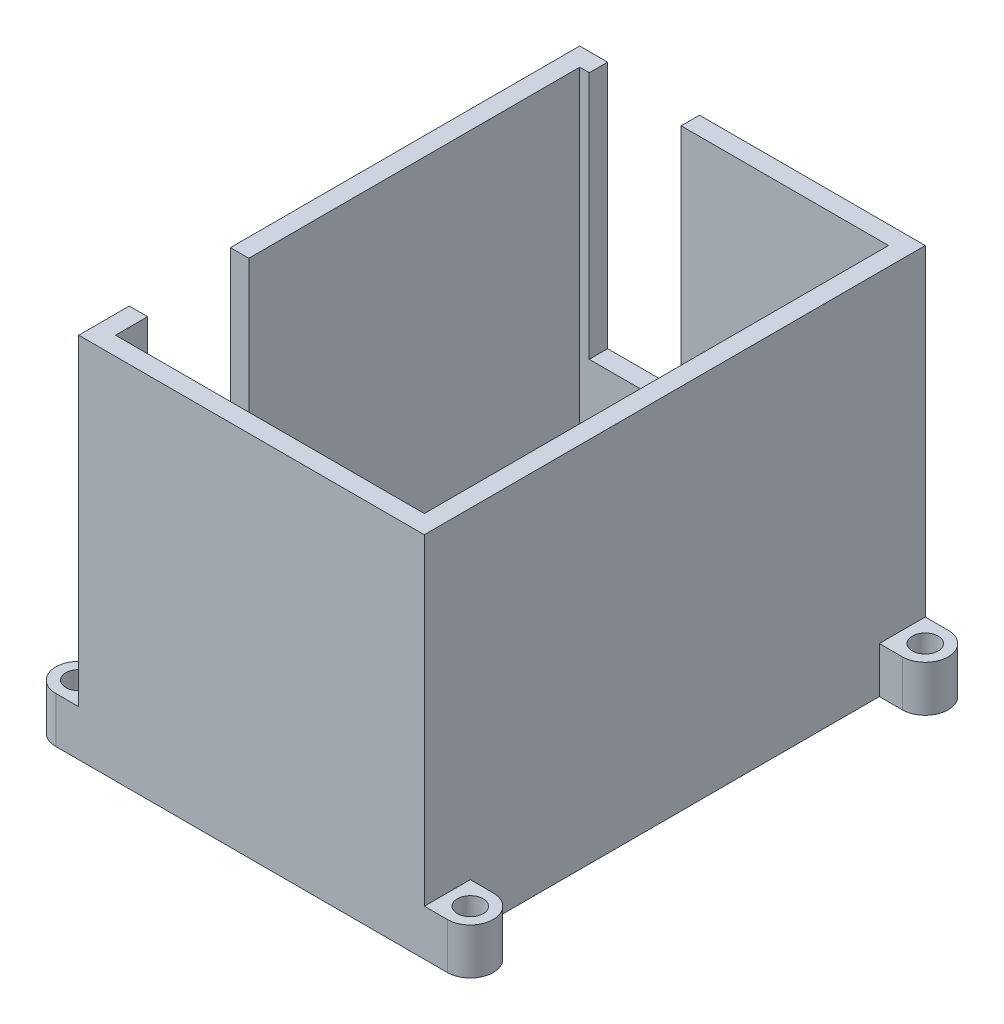
from build123d import *

# Parameters (mm, degrees)
SKETCH1_W                       = 47.752
SKETCH1_H                       = 69.215
SKETCH1_W_2                     = 42.672
SKETCH1_H_2                     = 64.135
BOSS_EXTRUDE1_DEPTH             = 50.8
BOSS_EXTRUDE2_DEPTH             = 6.35
F_9_64_0_14063_DIAMETER_HOLE1_D = 3.572002
SKETCH11_W                      = 13.97
SKETCH11_H                      = 38.735
CUT_EXTRUDE1_DEPTH              = 6.35
SKETCH12_W                      = 12.7
SKETCH12_H                      = 34.29
CUT_EXTRUDE2_DEPTH              = 6.35


with BuildPart() as part:
    # Sketch1 → Boss-Extrude1 (new body)
    with BuildSketch(Plane(origin=(0, 0, 0), x_dir=(1, 0, 0), z_dir=(0, 1, 0))):
        with Locations((21.336, 32.0675)):
            Rectangle(SKETCH1_W, SKETCH1_H)
        with Locations((21.336, 32.0675)):
            Rectangle(SKETCH1_W_2, SKETCH1_H_2, mode=Mode.SUBTRACT)
    extrude(amount=BOSS_EXTRUDE1_DEPTH)

    # Sketch2 → Boss-Extrude2 (add)
    with BuildSketch(Plane.XZ):
        with BuildLine():
            Line((-5.715, -3.81), (-2.54, -3.81))
            Line((-2.54, -3.81), (-2.54, 2.54))
            Line((-2.54, 2.54), (-5.715, 2.54))
            ThreePointArc((-5.715, 2.54), (-8.89, -0.635), (-5.715, -3.81))
        make_face()
        with BuildLine():
            Line((48.387, -60.325), (45.212, -60.325))
            Line((45.212, -60.325), (45.212, -66.675))
            Line((45.212, -66.675), (48.387, -66.675))
            ThreePointArc((48.387, -66.675), (51.562, -63.5), (48.387, -60.325))
        make_face()
        with BuildLine():
            Line((-2.54, -66.675), (-5.715, -66.675))
            ThreePointArc((-5.715, -66.675), (-8.89, -63.5), (-5.715, -60.325))
            Line((-5.715, -60.325), (-2.54, -60.325))
            Line((-2.54, -60.325), (-2.54, -66.675))
        make_face()
        with BuildLine():
            Line((45.212, 2.54), (48.387, 2.54))
            ThreePointArc((48.387, 2.54), (51.562, -0.635), (48.387, -3.81))
            Line((48.387, -3.81), (45.212, -3.81))
            Line((45.212, -3.81), (45.212, 2.54))
        make_face()
    extrude(amount=-BOSS_EXTRUDE2_DEPTH)

    # 9/64 (0.14063) Diameter Hole1 (through all)
    with Locations(Plane(origin=(0, 6.35, 0), x_dir=(1, 0, 0), z_dir=(0, 1, 0))):
        with Locations((-5.715, 0.635), (-5.715, 63.5), (48.387, 63.5), (48.387, 0.635)):
            Hole(F_9_64_0_14063_DIAMETER_HOLE1_D / 2)

    # Sketch11 → Cut-Extrude1 (cut)
    with BuildSketch(Plane.ZY.offset(2.54)):
        with Locations((-11.43, 31.4325)):
            Rectangle(SKETCH11_W, SKETCH11_H)
    extrude(amount=-CUT_EXTRUDE1_DEPTH, mode=Mode.SUBTRACT)

    # Sketch12 → Cut-Extrude2 (cut)
    with BuildSketch(Plane(origin=(0, 0, -66.675), x_dir=(-1, 0, 0), z_dir=(0, 0, -1))):
        with Locations((-7.6708, 33.655)):
            Rectangle(SKETCH12_W, SKETCH12_H)
    extrude(amount=-CUT_EXTRUDE2_DEPTH, mode=Mode.SUBTRACT)


solid = part.part
